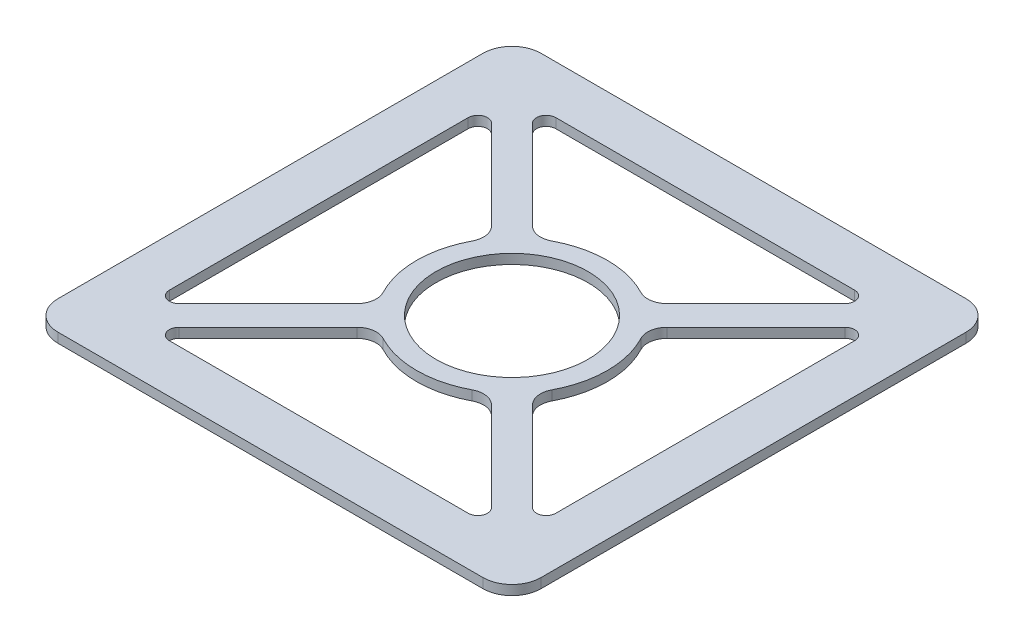
from build123d import *

# Parameters (mm, degrees)
SKETCH1_W          = 50
SKETCH1_H          = 50
SKETCH1_R          = 7.875
BASE_FLANGE1_DEPTH = 1
FILLET1_R          = 3
FILLET2_R          = 1
FILLET3_R          = 2


# Sheet-metal steps are written as plain solids
with BuildPart() as part:
    # Sketch1 → Base-Flange1 (new body)
    with BuildSketch(Plane(origin=(0, 0, 0), x_dir=(1, 0, 0), z_dir=(0, 1, 0))):
        Rectangle(SKETCH1_W, SKETCH1_H)
        with Locations(Location((0, 0, 0), (0, 0, 270))):
            Circle(SKETCH1_R, mode=Mode.SUBTRACT)
        with BuildLine():
            Line((20, 17.878679656), (20, -17.878679656))
            Line((20, -17.878679656), (7.962313054, -5.84099271))
            ThreePointArc((7.962313054, -5.84099271), (9.875, 0), (7.962313054, 5.84099271))
            Line((7.962313054, 5.84099271), (20, 17.878679656))
        make_face(mode=Mode.SUBTRACT)
        with BuildLine():
            Line((17.878679656, -20), (-17.878679656, -20))
            Line((-17.878679656, -20), (-5.84099271, -7.962313054))
            ThreePointArc((-5.84099271, -7.962313054), (0, -9.875), (5.84099271, -7.962313054))
            Line((5.84099271, -7.962313054), (17.878679656, -20))
        make_face(mode=Mode.SUBTRACT)
        with BuildLine():
            Line((-20, -17.878679656), (-20, 17.878679656))
            Line((-20, 17.878679656), (-7.962313054, 5.84099271))
            ThreePointArc((-7.962313054, 5.84099271), (-9.875, 0), (-7.962313054, -5.84099271))
            Line((-7.962313054, -5.84099271), (-20, -17.878679656))
        make_face(mode=Mode.SUBTRACT)
        with BuildLine():
            Line((-17.878679656, 20), (17.878679656, 20))
            Line((17.878679656, 20), (5.84099271, 7.962313054))
            ThreePointArc((5.84099271, 7.962313054), (0, 9.875), (-5.84099271, 7.962313054))
            Line((-5.84099271, 7.962313054), (-17.878679656, 20))
        make_face(mode=Mode.SUBTRACT)
    extrude(amount=-BASE_FLANGE1_DEPTH)

    # Fillet1
    fillet1_edges = [part.edges().sort_by_distance(p)[0] for p in [
        (25, -0.5, 25),
        (-25, -0.5, 25),
        (-25, -0.5, -25),
        (25, -0.5, -25),
    ]]
    fillet(fillet1_edges, radius=FILLET1_R)

    # Fillet2
    fillet2_edges = [part.edges().sort_by_distance(p)[0] for p in [
        (17.878679656, -0.5, 20),
        (-17.878679656, -0.5, 20),
        (20, -0.5, -17.878679656),
        (20, -0.5, 17.878679656),
        (17.878679656, -0.5, -20),
        (-17.878679656, -0.5, -20),
        (-20, -0.5, -17.878679656),
        (-20, -0.5, 17.878679656),
    ]]
    fillet(fillet2_edges, radius=FILLET2_R)

    # Fillet3
    fillet3_edges = [part.edges().sort_by_distance(p)[0] for p in [
        (-5.84099271, -0.5, 7.962313054),
        (5.84099271, -0.5, 7.962313054),
        (7.962313054, -0.5, -5.84099271),
        (7.962313054, -0.5, 5.84099271),
        (5.84099271, -0.5, -7.962313054),
        (-5.84099271, -0.5, -7.962313054),
        (-7.962313054, -0.5, -5.84099271),
        (-7.962313054, -0.5, 5.84099271),
    ]]
    fillet(fillet3_edges, radius=FILLET3_R)


solid = part.part
